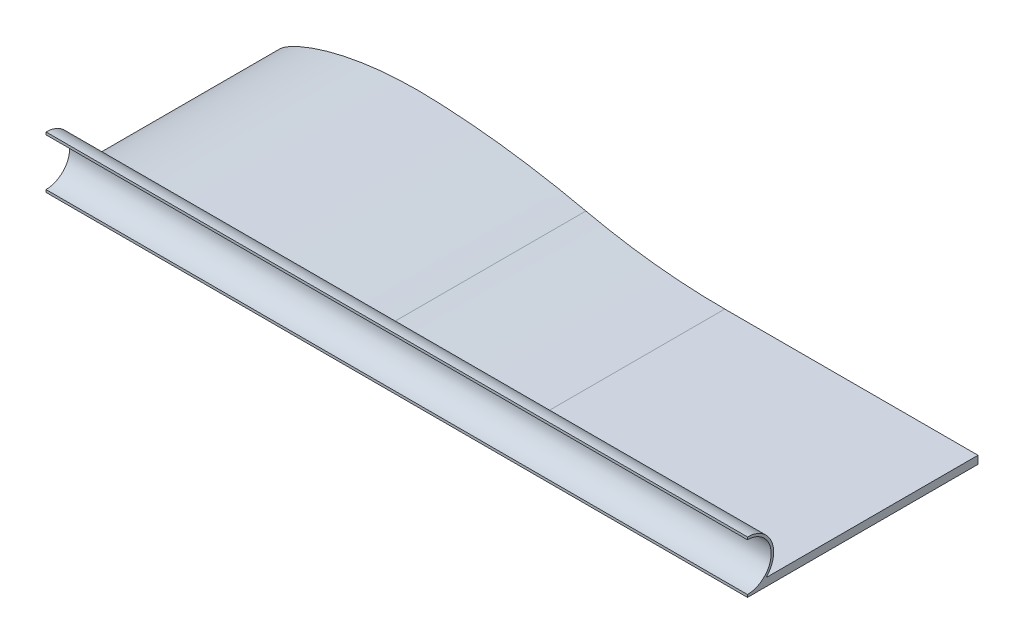
from build123d import *

# Parameters (mm, degrees)
BOSS_EXTRUDE1_DEPTH     = 185.42
FILLET1_R               = 508
BOSS_EXTRUDE2_START     = -0.366692026
BOSS_EXTRUDE2_DEPTH     = 564.246692026
CUT_EXTRUDE1_DEPTH      = 596.178860778
CUT_EXTRUDE1_DEPTH_BACK = 596.178860778


# Read off the part's stored shape, not the designer's step: Boss-Extrude2
with BuildPart() as part:
    # Sketch1 → Boss-Extrude1 (new body)
    with BuildSketch(Plane.XY):
        with BuildLine():
            add(Edge.make_bspline(
                [(13.161115253, -3.654646631), (13.823623725, -3.654646631), (16.987832029, -3.616054402), (23.087716531, -3.309495072), (31.861742479, -2.560725044), (41.843709875, -1.536189628), (52.931986121, -0.324549043), (65.008512648, 0.982737613), (77.964122557, 2.277511633), (91.674031486, 3.446601281), (106.020407657, 4.412124839), (120.955345623, 5.051776243), (136.33914131, 5.410297234), (152.00771634, 5.729330171), (167.715786189, 5.891355535), (183.286749283, 5.907819478), (198.553027185, 5.759500833), (213.347799024, 5.457376615), (227.508384674, 5.013382487), (240.87707765, 4.458546495), (253.302348042, 3.819562542), (264.636493621, 3.140644353), (274.759317931, 2.451673351), (283.511762664, 1.803338009), (290.902443864, 1.207394425), (296.53666063, 0.74243374), (301.097723542, 0.310240549), (302.984341567, 0.206591886), (304.793276654, -0.029609745), (304.8, 0)],
                knots=[0.530802003, 0.530802003, 0.530802003, 0.530802003, 0.533991629, 0.546033957, 0.560220284, 0.576403357, 0.594370816, 0.613951104, 0.634916885, 0.657088503, 0.68022991, 0.704175481, 0.729090367, 0.754353776, 0.779667752, 0.80476012, 0.829359339, 0.85320871, 0.876041363, 0.897604065, 0.917662212, 0.93596986, 0.952309788, 0.966502759, 0.978350083, 0.987731492, 0.99451092, 0.998633933, 1, 1, 1, 1], degree=3))
            Line((13.161115253, -3.654646631), (563.88, -3.654646631))
            Line((563.88, -3.654646631), (563.88, 2.695353369))
            Line((563.88, 2.695353369), (295.985175517, 2.695353369))
            add(Edge.make_bspline(
                [(304.8, 0), (304.806765113, 0.029793691), (303.042265442, 0.505757681), (301.260699108, 1.131288287), (298.363634875, 1.98706409), (296.481226949, 2.547598218), (295.985175517, 2.695353369)],
                knots=[0, 0, 0, 0, 0.001374553, 0.005484497, 0.012273361, 0.014741887, 0.014741887, 0.014741887, 0.014741887], degree=3))
        make_face()
        with BuildLine():
            add(Edge.make_bspline(
                [(304.8, 0), (304.806765113, 0.029793691), (303.042265442, 0.505757681), (301.260699108, 1.131288287), (296.859481645, 2.431382143), (291.428347564, 4.059507507), (284.27148123, 6.106238287), (275.759062516, 8.441011906), (265.86759503, 11.013912173), (254.728284103, 13.723951628), (242.452197766, 16.50134202), (229.161916523, 19.249453844), (215.002240334, 21.891859808), (200.122077246, 24.347664434), (184.681833302, 26.544941892), (168.851714948, 28.423390706), (152.808183209, 29.930661937), (136.726583629, 31.004871005), (120.70505044, 31.68890838), (104.913675716, 31.696173318), (89.564892405, 30.886228683), (74.937803443, 29.370910292), (61.220730955, 27.223316908), (48.586751334, 24.554045511), (37.186133391, 21.501101472), (27.155274661, 18.197077887), (18.596928301, 14.804467146), (11.606371729, 11.436038832), (6.205374616, 8.263160289), (2.462071155, 5.310219357), (0.172825892, 2.718078099), (-0.366692026, -0.10672571), (1.618538644, -2.175191533), (4.903129138, -3.111787797), (9.54050067, -3.659044511), (15.622325024, -3.684680114), (23.087716531, -3.309495072), (31.861742479, -2.560725044), (41.843709875, -1.536189628), (52.931986121, -0.324549043), (65.008512648, 0.982737613), (77.964122557, 2.277511633), (91.674031486, 3.446601281), (106.020407657, 4.412124839), (120.955345623, 5.051776243), (136.33914131, 5.410297234), (152.00771634, 5.729330171), (167.715786189, 5.891355535), (183.286749283, 5.907819478), (198.553027185, 5.759500833), (213.347799024, 5.457376615), (227.508384674, 5.013382487), (240.87707765, 4.458546495), (253.302348042, 3.819562542), (264.636493621, 3.140644353), (274.759317931, 2.451673351), (283.511762664, 1.803338009), (290.902443864, 1.207394425), (296.53666063, 0.74243374), (301.097723542, 0.310240549), (302.984341567, 0.206591886), (304.793276654, -0.029609745), (304.8, 0)],
                knots=[0, 0, 0, 0, 0.001374553, 0.005484497, 0.012273361, 0.021682196, 0.033580612, 0.047830743, 0.064305953, 0.082777332, 0.103063756, 0.124929017, 0.148149111, 0.172444695, 0.197572106, 0.223268881, 0.249227775, 0.275186209, 0.300900709, 0.326462938, 0.351222485, 0.374905859, 0.397269706, 0.418072414, 0.437079533, 0.454093094, 0.468919632, 0.481391712, 0.491447127, 0.499023571, 0.504293734, 0.507921918, 0.511539686, 0.516780528, 0.52421649, 0.533991629, 0.546033957, 0.560220284, 0.576403357, 0.594370816, 0.613951104, 0.634916885, 0.657088503, 0.68022991, 0.704175481, 0.729090367, 0.754353776, 0.779667752, 0.80476012, 0.829359339, 0.85320871, 0.876041363, 0.897604065, 0.917662212, 0.93596986, 0.952309788, 0.966502759, 0.978350083, 0.987731492, 0.99451092, 0.998633933, 1, 1, 1, 1], degree=3))
        make_face()
    extrude(amount=BOSS_EXTRUDE1_DEPTH)

    # Fillet1
    fillet1_edges = [part.edges().sort_by_distance(p)[0] for p in [
        (295.985175517, 2.695353369, 92.71),
    ]]
    fillet(fillet1_edges, radius=FILLET1_R)

    # Boss-Extrude2 outline → Boss-Extrude2 (add)
    with BuildSketch(Plane(origin=(0, 0, 0), x_dir=(0, 0, -1), z_dir=(1, 0, 0)).offset(BOSS_EXTRUDE2_START)):
        with BuildLine():
            ThreePointArc((-185.42, -3.654646631), (-164.338, 17.427353369), (-185.42, 38.509353369))
            Line((-185.42, 38.509353369), (-185.42, -3.654646631))
        make_face()
    extrude(amount=BOSS_EXTRUDE2_DEPTH)

    # Sketch3 → Cut-Extrude1 (cut, two sides: drawn at the far end of the back side and taken through both)
    with BuildSketch(Plane.ZY.offset(0.366692026).offset(-CUT_EXTRUDE1_DEPTH_BACK)):
        with BuildLine():
            Line((185.42, -1.622646631), (185.42, 36.477353369))
            ThreePointArc((185.42, 36.477353369), (166.37, 17.427353369), (185.42, -1.622646631))
        make_face()
    extrude(amount=CUT_EXTRUDE1_DEPTH + CUT_EXTRUDE1_DEPTH_BACK, mode=Mode.SUBTRACT)


solid = part.part
